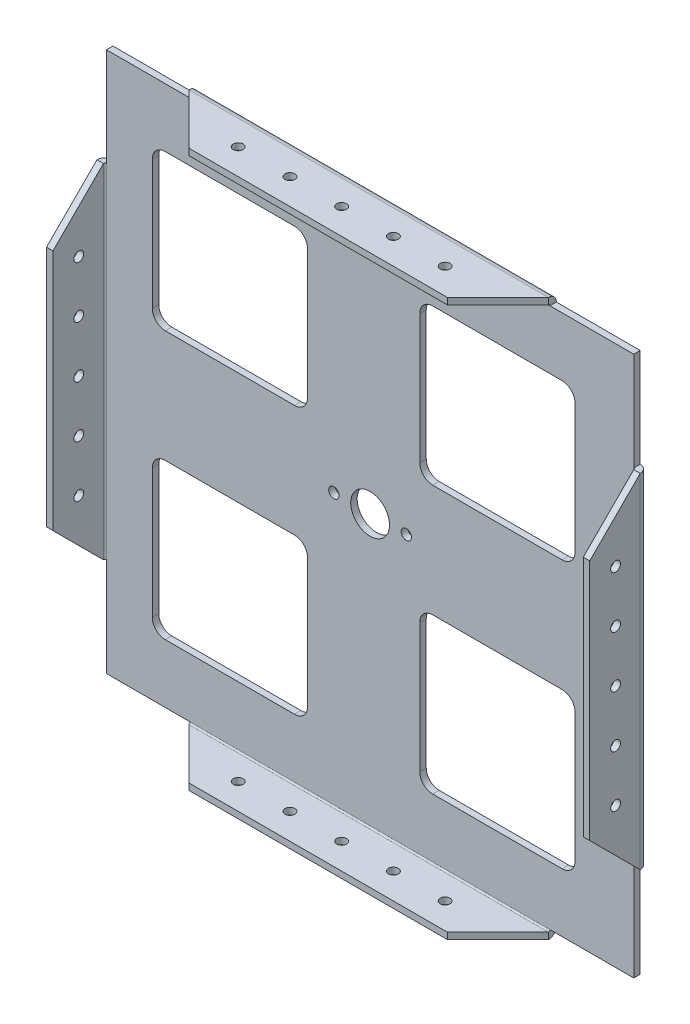
from build123d import *

# Parameters (mm, degrees)
SKETCH1_W                     = 266.7
SKETCH1_H                     = 273.05
SKETCH1_R                     = 9.525
SKETCH1_R_2                   = 2.54
BASE_FLANGE4_DEPTH            = 3.175
EDGE_FLANGE13_STRIP_W         = 14.1732
EDGE_FLANGE13_STRIP_H         = 3.175
EDGE_FLANGE13_STRIP_CUT_DEPTH = 266.7
EDGE_FLANGE13_DEPTH           = 266.7
EDGE_FLANGE14_STRIP_W         = 14.1732
EDGE_FLANGE14_STRIP_H         = 3.175
EDGE_FLANGE14_STRIP_CUT_DEPTH = 266.7
EDGE_FLANGE14_DEPTH           = 266.7
SKETCH97_W                    = 44.45
SKETCH97_H                    = 24.7904
CUT_EXTRUDE17_DEPTH           = 47.752
SKETCH98_W                    = 44.45
SKETCH98_H                    = 24.7904
CUT_EXTRUDE18_DEPTH           = 47.752
SKETCH99_W                    = 44.45
SKETCH99_H                    = 24.7904
CUT_EXTRUDE19_DEPTH           = 47.752
SKETCH100_W                   = 44.45
SKETCH100_H                   = 24.7904
CUT_EXTRUDE20_DEPTH           = 47.752
EDGE_FLANGE15_STRIP_W         = 14.1732
EDGE_FLANGE15_STRIP_H         = 3.175
EDGE_FLANGE15_STRIP_CUT_DEPTH = 265.2268
EDGE_FLANGE15_DEPTH           = 265.2268
EDGE_FLANGE16_STRIP_W         = 14.1732
EDGE_FLANGE16_STRIP_H         = 3.175
EDGE_FLANGE16_STRIP_CUT_DEPTH = 265.2268
EDGE_FLANGE16_DEPTH           = 265.2268
SKETCH107_W                   = 24.7904
SKETCH107_H                   = 47.752
CUT_EXTRUDE21_DEPTH           = 47.752
SKETCH108_W                   = 24.7904
SKETCH108_H                   = 47.752
CUT_EXTRUDE22_DEPTH           = 47.752
SKETCH109_W                   = 24.7904
SKETCH109_H                   = 47.752
CUT_EXTRUDE23_DEPTH           = 47.752
SKETCH110_W                   = 24.7904
SKETCH110_H                   = 47.752
CUT_EXTRUDE24_DEPTH           = 47.752
CHAMFER5_SIZE                 = 25.4
SKETCH113_R                   = 2.413
CUT_EXTRUDE25_DEPTH           = 306.44213946
SKETCH114_R                   = 2.413
CUT_EXTRUDE26_DEPTH           = 316.967399731
CUT_EXTRUDE28_START           = -45.0596
CUT_EXTRUDE28_DEPTH           = 45.0596
CUT_EXTRUDE29_DEPTH           = 45.0596
CUT_EXTRUDE30_START           = -48.3616
CUT_EXTRUDE30_DEPTH           = 48.3616
CUT_EXTRUDE31_DEPTH           = 45.0596
CUT_EXTRUDE32_START           = -45.0596
CUT_EXTRUDE32_DEPTH           = 45.0596
CUT_EXTRUDE33_DEPTH           = 48.3616
CUT_EXTRUDE34_DEPTH           = 48.3616
CUT_EXTRUDE35_START           = -48.3616
CUT_EXTRUDE35_DEPTH           = 48.3616


# Sheet-metal steps are written as plain solids
with BuildPart() as part:
    # Sketch1 → Base-Flange4 (new body)
    with BuildSketch(Plane.XY):
        with Locations((1.137807361, -30.97091029)):
            Rectangle(SKETCH1_W, SKETCH1_H)
        with Locations((1.137807361, -30.97091029)):
            Circle(SKETCH1_R, mode=Mode.SUBTRACT)
        with Locations((-16.642192639, -30.84391029)):
            Circle(SKETCH1_R_2, mode=Mode.SUBTRACT)
        with Locations((18.917353784, -30.84391029)):
            Circle(SKETCH1_R_2, mode=Mode.SUBTRACT)
        with BuildLine():
            Line((-99.446192639, 72.78808971), (-35.946192639, 72.78808971))
            ThreePointArc((-35.946192639, 72.78808971), (-31.456064579, 70.92821777), (-29.596192639, 66.43808971))
            Line((-29.596192639, 66.43808971), (-29.596192639, 2.93808971))
            ThreePointArc((-29.596192639, 2.93808971), (-31.456064579, -1.552038351), (-35.946192639, -3.41191029))
            Line((-35.946192639, -3.41191029), (-99.446192639, -3.41191029))
            ThreePointArc((-99.446192639, -3.41191029), (-103.9363207, -1.552038351), (-105.796192639, 2.93808971))
            Line((-105.796192639, 2.93808971), (-105.796192639, 66.43808971))
            ThreePointArc((-105.796192639, 66.43808971), (-103.9363207, 70.92821777), (-99.446192639, 72.78808971))
        make_face(mode=Mode.SUBTRACT)
        with BuildLine():
            Line((31.871807361, 72.78808971), (95.371807361, 72.78808971))
            ThreePointArc((95.371807361, 72.78808971), (99.861935421, 70.92821777), (101.721807361, 66.43808971))
            Line((101.721807361, 66.43808971), (101.721807361, 2.93808971))
            ThreePointArc((101.721807361, 2.93808971), (99.861935421, -1.552038351), (95.371807361, -3.41191029))
            Line((95.371807361, -3.41191029), (31.871807361, -3.41191029))
            ThreePointArc((31.871807361, -3.41191029), (27.3816793, -1.552038351), (25.521807361, 2.93808971))
            Line((25.521807361, 2.93808971), (25.521807361, 66.43808971))
            ThreePointArc((25.521807361, 66.43808971), (27.3816793, 70.92821777), (31.871807361, 72.78808971))
        make_face(mode=Mode.SUBTRACT)
        with BuildLine():
            Line((-99.446192639, -58.52991029), (-35.946192639, -58.52991029))
            ThreePointArc((-35.946192639, -58.52991029), (-31.456064579, -60.38978223), (-29.596192639, -64.87991029))
            Line((-29.596192639, -64.87991029), (-29.596192639, -128.37991029))
            ThreePointArc((-29.596192639, -128.37991029), (-31.456064579, -132.870038351), (-35.946192639, -134.72991029))
            Line((-35.946192639, -134.72991029), (-99.446192639, -134.72991029))
            ThreePointArc((-99.446192639, -134.72991029), (-103.9363207, -132.870038351), (-105.796192639, -128.37991029))
            Line((-105.796192639, -128.37991029), (-105.796192639, -64.87991029))
            ThreePointArc((-105.796192639, -64.87991029), (-103.9363207, -60.38978223), (-99.446192639, -58.52991029))
        make_face(mode=Mode.SUBTRACT)
        with BuildLine():
            Line((31.871807361, -58.52991029), (95.371807361, -58.52991029))
            ThreePointArc((95.371807361, -58.52991029), (99.861935421, -60.38978223), (101.721807361, -64.87991029))
            Line((101.721807361, -64.87991029), (101.721807361, -128.37991029))
            ThreePointArc((101.721807361, -128.37991029), (99.861935421, -132.870038351), (95.371807361, -134.72991029))
            Line((95.371807361, -134.72991029), (31.871807361, -134.72991029))
            ThreePointArc((31.871807361, -134.72991029), (27.3816793, -132.870038351), (25.521807361, -128.37991029))
            Line((25.521807361, -128.37991029), (25.521807361, -64.87991029))
            ThreePointArc((25.521807361, -64.87991029), (27.3816793, -60.38978223), (31.871807361, -58.52991029))
        make_face(mode=Mode.SUBTRACT)
    extrude(amount=-BASE_FLANGE4_DEPTH)

    # Edge-Flange13 strip (across the edge) → Edge-Flange13 strip cut (cut)
    with BuildSketch(Plane(origin=(-132.212192639, -167.49591029, 0), x_dir=(0, 1, 0), z_dir=(1, 0, 0))):
        with Locations((-3.175, -1.5875)):
            Rectangle(EDGE_FLANGE13_STRIP_W, EDGE_FLANGE13_STRIP_H)
    extrude(amount=EDGE_FLANGE13_STRIP_CUT_DEPTH, mode=Mode.SUBTRACT)

    # Edge-Flange13 section (across the edge) → Edge-Flange13 (add)
    with BuildSketch(Plane(origin=(-132.212192639, -167.49591029, 0), x_dir=(0, 1, 0), z_dir=(1, 0, 0))):
        with BuildLine():
            Line((0, 0.7366), (0, 25.527))
            Line((0, 25.527), (3.175, 25.527))
            Line((3.175, 25.527), (3.175, 0.7366))
            ThreePointArc((3.175, 0.7366), (3.390745145, 0.215745145), (3.9116, 0))
            Line((3.9116, 0), (3.9116, -3.175))
            ThreePointArc((3.9116, -3.175), (1.145681115, -2.029318885), (0, 0.7366))
        make_face()
    extrude(amount=EDGE_FLANGE13_DEPTH)

    # Edge-Flange14 strip (across the edge) → Edge-Flange14 strip cut (cut)
    with BuildSketch(Plane(origin=(134.487807361, 105.55408971, 0), x_dir=(0, -1, 0), z_dir=(-1, 0, 0))):
        with Locations((-3.175, -1.5875)):
            Rectangle(EDGE_FLANGE14_STRIP_W, EDGE_FLANGE14_STRIP_H)
    extrude(amount=EDGE_FLANGE14_STRIP_CUT_DEPTH, mode=Mode.SUBTRACT)

    # Edge-Flange14 section (across the edge) → Edge-Flange14 (add)
    with BuildSketch(Plane(origin=(134.487807361, 105.55408971, 0), x_dir=(0, -1, 0), z_dir=(-1, 0, 0))):
        with BuildLine():
            Line((0, 0.7366), (0, 25.527))
            Line((0, 25.527), (3.175, 25.527))
            Line((3.175, 25.527), (3.175, 0.7366))
            ThreePointArc((3.175, 0.7366), (3.390745145, 0.215745145), (3.9116, 0))
            Line((3.9116, 0), (3.9116, -3.175))
            ThreePointArc((3.9116, -3.175), (1.145681115, -2.029318885), (0, 0.7366))
        make_face()
    extrude(amount=EDGE_FLANGE14_DEPTH)

    # Sketch97 → Cut-Extrude17 (cut)
    with BuildSketch(Plane(origin=(0, -164.32091029, 0), x_dir=(1, 0, 0), z_dir=(0, 1, 0))):
        with Locations((112.262807361, -13.1318)):
            Rectangle(SKETCH97_W, SKETCH97_H)
    extrude(amount=-CUT_EXTRUDE17_DEPTH, mode=Mode.SUBTRACT)

    # Sketch98 → Cut-Extrude18 (cut)
    with BuildSketch(Plane(origin=(0, -164.32091029, 0), x_dir=(1, 0, 0), z_dir=(0, 1, 0))):
        with Locations((-109.987192639, -13.1318)):
            Rectangle(SKETCH98_W, SKETCH98_H)
    extrude(amount=-CUT_EXTRUDE18_DEPTH, mode=Mode.SUBTRACT)

    # Sketch99 → Cut-Extrude19 (cut)
    with BuildSketch(Plane(origin=(0, 105.55408971, 0), x_dir=(1, 0, 0), z_dir=(0, 1, 0))):
        with Locations((112.262807361, -13.1318)):
            Rectangle(SKETCH99_W, SKETCH99_H)
    extrude(amount=-CUT_EXTRUDE19_DEPTH, mode=Mode.SUBTRACT)

    # Sketch100 → Cut-Extrude20 (cut)
    with BuildSketch(Plane(origin=(0, 105.55408971, 0), x_dir=(1, 0, 0), z_dir=(0, 1, 0))):
        with Locations((-109.987192639, -13.1318)):
            Rectangle(SKETCH100_W, SKETCH100_H)
    extrude(amount=-CUT_EXTRUDE20_DEPTH, mode=Mode.SUBTRACT)

    # Edge-Flange15 strip (across the edge) → Edge-Flange15 strip cut (cut)
    with BuildSketch(Plane(origin=(134.487807361, -163.58431029, 0), x_dir=(-1, 0, 0), z_dir=(0, 1, 0))):
        with Locations((-3.175, -1.5875)):
            Rectangle(EDGE_FLANGE15_STRIP_W, EDGE_FLANGE15_STRIP_H)
    extrude(amount=EDGE_FLANGE15_STRIP_CUT_DEPTH, mode=Mode.SUBTRACT)

    # Edge-Flange15 section (across the edge) → Edge-Flange15 (add)
    with BuildSketch(Plane(origin=(134.487807361, -163.58431029, 0), x_dir=(-1, 0, 0), z_dir=(0, 1, 0))):
        with BuildLine():
            Line((0, 0.7366), (0, 25.527))
            Line((0, 25.527), (3.175, 25.527))
            Line((3.175, 25.527), (3.175, 0.7366))
            ThreePointArc((3.175, 0.7366), (3.390745145, 0.215745145), (3.9116, 0))
            Line((3.9116, 0), (3.9116, -3.175))
            ThreePointArc((3.9116, -3.175), (1.145681115, -2.029318885), (0, 0.7366))
        make_face()
    extrude(amount=EDGE_FLANGE15_DEPTH)

    # Edge-Flange16 strip (across the edge) → Edge-Flange16 strip cut (cut)
    with BuildSketch(Plane(origin=(-132.212192639, 101.64248971, 0), x_dir=(1, 0, 0), z_dir=(0, -1, 0))):
        with Locations((-3.175, -1.5875)):
            Rectangle(EDGE_FLANGE16_STRIP_W, EDGE_FLANGE16_STRIP_H)
    extrude(amount=EDGE_FLANGE16_STRIP_CUT_DEPTH, mode=Mode.SUBTRACT)

    # Edge-Flange16 section (across the edge) → Edge-Flange16 (add)
    with BuildSketch(Plane(origin=(-132.212192639, 101.64248971, 0), x_dir=(1, 0, 0), z_dir=(0, -1, 0))):
        with BuildLine():
            Line((0, 0.7366), (0, 25.527))
            Line((0, 25.527), (3.175, 25.527))
            Line((3.175, 25.527), (3.175, 0.7366))
            ThreePointArc((3.175, 0.7366), (3.390745145, 0.215745145), (3.9116, 0))
            Line((3.9116, 0), (3.9116, -3.175))
            ThreePointArc((3.9116, -3.175), (1.145681115, -2.029318885), (0, 0.7366))
        make_face()
    extrude(amount=EDGE_FLANGE16_DEPTH)

    # Sketch107 → Cut-Extrude21 (cut)
    with BuildSketch(Plane.ZY.offset(132.212192639)):
        with Locations((13.1318, 77.76648971)):
            Rectangle(SKETCH107_W, SKETCH107_H)
    extrude(amount=-CUT_EXTRUDE21_DEPTH, mode=Mode.SUBTRACT)

    # Sketch108 → Cut-Extrude22 (cut)
    with BuildSketch(Plane.ZY.offset(132.212192639)):
        with Locations((13.1318, -139.70831029)):
            Rectangle(SKETCH108_W, SKETCH108_H)
    extrude(amount=-CUT_EXTRUDE22_DEPTH, mode=Mode.SUBTRACT)

    # Sketch109 → Cut-Extrude23 (cut)
    with BuildSketch(Plane(origin=(134.487807361, 0, 0), x_dir=(0, 0, -1), z_dir=(1, 0, 0))):
        with Locations((-13.1318, -139.70831029)):
            Rectangle(SKETCH109_W, SKETCH109_H)
    extrude(amount=-CUT_EXTRUDE23_DEPTH, mode=Mode.SUBTRACT)

    # Sketch110 → Cut-Extrude24 (cut)
    with BuildSketch(Plane(origin=(134.487807361, 0, 0), x_dir=(0, 0, -1), z_dir=(1, 0, 0))):
        with Locations((-13.1318, 77.76648971)):
            Rectangle(SKETCH110_W, SKETCH110_H)
    extrude(amount=-CUT_EXTRUDE24_DEPTH, mode=Mode.SUBTRACT)

    # Chamfer5
    # the kernel refuses this chamfer: 25.4 mm, written as the material it takes off along each edge
    with BuildSketch(Plane(origin=(90.037807361, -99.000162396, 25.527), x_dir=(-0.9996219169112966, 0, 0.027495876610586324), z_dir=(0, -1, 0))) as chamfer5_piece_1_section:
        Polygon((CHAMFER5_SIZE * 0.999621916911, CHAMFER5_SIZE * 0.0274958766106), (-CHAMFER5_SIZE * 0.0274958766106, CHAMFER5_SIZE * 0.999621916911), (0, 0), align=None)
    chamfer5_piece_1 = extrude(amount=133.816495789, mode=Mode.PRIVATE)
    chamfer5_piece_1 = split(chamfer5_piece_1, bisect_by=Plane(origin=(81.623550107, -165.90841029, 0.7366), z_dir=(0, 0, 1)), keep=Keep.TOP, mode=Mode.PRIVATE)
    add(chamfer5_piece_1, mode=Mode.SUBTRACT)
    with BuildSketch(Plane(origin=(199.808555255, -115.83231029, 25.527), x_dir=(-3.257797378778914e-15, -0.0274958766105862, -0.9996219169112966), z_dir=(-1, 0, 0))) as chamfer5_piece_2_section:
        Polygon((CHAMFER5_SIZE * 0.999621916911, -CHAMFER5_SIZE * 0.0274958766106), (-CHAMFER5_SIZE * 0.0274958766106, -CHAMFER5_SIZE * 0.999621916911), (0, 0), align=None)
    chamfer5_piece_2 = extrude(amount=133.816495789, mode=Mode.PRIVATE)
    chamfer5_piece_2 = split(chamfer5_piece_2, bisect_by=Plane(origin=(132.900307361, -107.418053037, 0.7366), z_dir=(0, 0, 1)), keep=Keep.TOP, mode=Mode.PRIVATE)
    add(chamfer5_piece_2, mode=Mode.SUBTRACT)
    with BuildSketch(Plane(origin=(-87.762192639, -99.000162396, 25.527), x_dir=(-0.0274958766105862, 3.2606747798650146e-15, -0.9996219169112966), z_dir=(0, -1, 0))) as chamfer5_piece_3_section:
        Polygon((CHAMFER5_SIZE * 0.999621916911, CHAMFER5_SIZE * 0.0274958766106), (-CHAMFER5_SIZE * 0.0274958766106, CHAMFER5_SIZE * 0.999621916911), (0, 0), align=None)
    chamfer5_piece_3 = extrude(amount=133.816495789, mode=Mode.PRIVATE)
    chamfer5_piece_3 = split(chamfer5_piece_3, bisect_by=Plane(origin=(-79.347935385, -165.90841029, 0.7366), z_dir=(0, 0, 1)), keep=Keep.TOP, mode=Mode.PRIVATE)
    add(chamfer5_piece_3, mode=Mode.SUBTRACT)
    with BuildSketch(Plane(origin=(-197.532940533, -115.83231029, 25.527), x_dir=(0, 0.9996219169112968, 0.027495876610586365), z_dir=(1, 0, 0))) as chamfer5_piece_4_section:
        Polygon((CHAMFER5_SIZE * 0.999621916911, -CHAMFER5_SIZE * 0.0274958766106), (-CHAMFER5_SIZE * 0.0274958766106, -CHAMFER5_SIZE * 0.999621916911), (0, 0), align=None)
    chamfer5_piece_4 = extrude(amount=133.816495789, mode=Mode.PRIVATE)
    chamfer5_piece_4 = split(chamfer5_piece_4, bisect_by=Plane(origin=(-130.624692639, -107.418053037, 0.7366), z_dir=(0, 0, 1)), keep=Keep.TOP, mode=Mode.PRIVATE)
    add(chamfer5_piece_4, mode=Mode.SUBTRACT)
    with BuildSketch(Plane(origin=(-197.532940533, 53.89048971, 25.527), x_dir=(4.344688972067252e-15, 0.027495876610586743, -0.9996219169112966), z_dir=(1, 0, 0))) as chamfer5_piece_5_section:
        Polygon((CHAMFER5_SIZE * 0.999621916911, -CHAMFER5_SIZE * 0.0274958766106), (-CHAMFER5_SIZE * 0.0274958766106, -CHAMFER5_SIZE * 0.999621916911), (0, 0), align=None)
    chamfer5_piece_5 = extrude(amount=133.816495789, mode=Mode.PRIVATE)
    chamfer5_piece_5 = split(chamfer5_piece_5, bisect_by=Plane(origin=(-130.624692639, 45.476232456, 0.7366), z_dir=(0, 0, 1)), keep=Keep.TOP, mode=Mode.PRIVATE)
    add(chamfer5_piece_5, mode=Mode.SUBTRACT)
    with BuildSketch(Plane(origin=(-87.762192639, 170.874837604, 25.527), x_dir=(0.9996219169112966, 0, 0.027495876610586324), z_dir=(0, -1, 0))) as chamfer5_piece_6_section:
        Polygon((CHAMFER5_SIZE * 0.999621916911, -CHAMFER5_SIZE * 0.0274958766106), (-CHAMFER5_SIZE * 0.0274958766106, -CHAMFER5_SIZE * 0.999621916911), (0, 0), align=None)
    chamfer5_piece_6 = extrude(amount=133.816495789, mode=Mode.PRIVATE)
    chamfer5_piece_6 = split(chamfer5_piece_6, bisect_by=Plane(origin=(-79.347935385, 103.96658971, 0.7366), z_dir=(0, 0, 1)), keep=Keep.TOP, mode=Mode.PRIVATE)
    add(chamfer5_piece_6, mode=Mode.SUBTRACT)
    with BuildSketch(Plane(origin=(199.808555255, 53.89048971, 25.527), x_dir=(0, -0.9996219169112968, 0.02749587661058633), z_dir=(-1, 0, 0))) as chamfer5_piece_7_section:
        Polygon((CHAMFER5_SIZE * 0.999621916911, -CHAMFER5_SIZE * 0.0274958766106), (-CHAMFER5_SIZE * 0.0274958766106, -CHAMFER5_SIZE * 0.999621916911), (0, 0), align=None)
    chamfer5_piece_7 = extrude(amount=133.816495789, mode=Mode.PRIVATE)
    chamfer5_piece_7 = split(chamfer5_piece_7, bisect_by=Plane(origin=(132.900307361, 45.476232456, 0.7366), z_dir=(0, 0, 1)), keep=Keep.TOP, mode=Mode.PRIVATE)
    add(chamfer5_piece_7, mode=Mode.SUBTRACT)
    with BuildSketch(Plane(origin=(90.037807361, 170.874837604, 25.527), x_dir=(0.0274958766105862, -3.2606747798650146e-15, -0.9996219169112966), z_dir=(0, -1, 0))) as chamfer5_piece_8_section:
        Polygon((CHAMFER5_SIZE * 0.999621916911, -CHAMFER5_SIZE * 0.0274958766106), (-CHAMFER5_SIZE * 0.0274958766106, -CHAMFER5_SIZE * 0.999621916911), (0, 0), align=None)
    chamfer5_piece_8 = extrude(amount=133.816495789, mode=Mode.PRIVATE)
    chamfer5_piece_8 = split(chamfer5_piece_8, bisect_by=Plane(origin=(81.623550107, 103.96658971, 0.7366), z_dir=(0, 0, 1)), keep=Keep.TOP, mode=Mode.PRIVATE)
    add(chamfer5_piece_8, mode=Mode.SUBTRACT)

    # Sketch113 → Cut-Extrude25 (cut, through all)
    with BuildSketch(Plane(origin=(0, 105.55408971, 0), x_dir=(1, 0, 0), z_dir=(0, 1, 0))):
        with Locations(Location((50.8, -12.827, 0), (0, 0, 270))):
            Circle(SKETCH113_R)
        with Locations(Location((25.4, -12.827, 0), (0, 0, 270))):
            Circle(SKETCH113_R)
        with Locations(Location((0, -12.827, 0), (0, 0, 270))):
            Circle(SKETCH113_R)
        with Locations(Location((-25.4, -12.827, 0), (0, 0, 270))):
            Circle(SKETCH113_R)
        with Locations(Location((-50.8, -12.827, 0), (0, 0, 270))):
            Circle(SKETCH113_R)
    extrude(amount=-CUT_EXTRUDE25_DEPTH, mode=Mode.SUBTRACT)

    # Sketch114 → Cut-Extrude26 (cut, through all)
    with BuildSketch(Plane(origin=(134.487807361, 0, 0), x_dir=(0, 0, -1), z_dir=(1, 0, 0))):
        with Locations((-12.827, -81.84711029)):
            Circle(SKETCH114_R)
        with Locations((-12.827, -56.44711029)):
            Circle(SKETCH114_R)
        with Locations((-12.827, -31.04711029)):
            Circle(SKETCH114_R)
        with Locations((-12.827, -5.64711029)):
            Circle(SKETCH114_R)
        with Locations((-12.827, 19.75288971)):
            Circle(SKETCH114_R)
    extrude(amount=-CUT_EXTRUDE26_DEPTH, mode=Mode.SUBTRACT)

    # Sketch115 → Cut-Extrude28 (cut)
    with BuildSketch(Plane(origin=(134.487807361, 0, 0), x_dir=(0, 0, -1), z_dir=(1, 0, 0)).offset(CUT_EXTRUDE28_START)):
        with BuildLine():
            Line((-0.7366, -167.49591029), (-0.7366, -164.32091029))
            ThreePointArc((-0.7366, -164.32091029), (-0.215745145, -164.105165145), (0, -163.58431029))
            Line((0, -163.58431029), (3.175, -163.58431029))
            ThreePointArc((3.175, -163.58431029), (2.029318885, -166.350229176), (-0.7366, -167.49591029))
        make_face()
    extrude(amount=CUT_EXTRUDE28_DEPTH, mode=Mode.SUBTRACT)

    # Sketch116 → Cut-Extrude29 (cut)
    with BuildSketch(Plane.ZY.offset(132.212192639)):
        with BuildLine():
            Line((0, -163.58431029), (-3.175, -163.58431029))
            ThreePointArc((-3.175, -163.58431029), (-2.029318885, -166.350229176), (0.7366, -167.49591029))
            Line((0.7366, -167.49591029), (0.7366, -164.32091029))
            ThreePointArc((0.7366, -164.32091029), (0.215745145, -164.105165145), (0, -163.58431029))
        make_face()
    extrude(amount=-CUT_EXTRUDE29_DEPTH, mode=Mode.SUBTRACT)

    # Sketch117 → Cut-Extrude30 (cut)
    with BuildSketch(Plane.XZ.offset(163.58431029).offset(CUT_EXTRUDE30_START)):
        with BuildLine():
            Line((-129.037192639, 0.7366), (-132.212192639, 0.7366))
            ThreePointArc((-132.212192639, 0.7366), (-131.066511524, -2.029318885), (-128.300592639, -3.175))
            Line((-128.300592639, -3.175), (-128.300592639, 0))
            ThreePointArc((-128.300592639, 0), (-128.821447494, 0.215745145), (-129.037192639, 0.7366))
        make_face()
    extrude(amount=CUT_EXTRUDE30_DEPTH, mode=Mode.SUBTRACT)

    # Sketch118 → Cut-Extrude31 (cut)
    with BuildSketch(Plane(origin=(134.487807361, 0, 0), x_dir=(0, 0, -1), z_dir=(1, 0, 0))):
        with BuildLine():
            Line((-0.7366, 102.37908971), (-0.7366, 105.55408971))
            ThreePointArc((-0.7366, 105.55408971), (2.029318885, 104.408408595), (3.175, 101.64248971))
            Line((3.175, 101.64248971), (0, 101.64248971))
            ThreePointArc((0, 101.64248971), (-0.215745145, 102.163344565), (-0.7366, 102.37908971))
        make_face()
    extrude(amount=-CUT_EXTRUDE31_DEPTH, mode=Mode.SUBTRACT)

    # Sketch119 → Cut-Extrude32 (cut)
    with BuildSketch(Plane.ZY.offset(132.212192639).offset(CUT_EXTRUDE32_START)):
        with BuildLine():
            Line((0.7366, 102.37908971), (0.7366, 105.55408971))
            ThreePointArc((0.7366, 105.55408971), (-2.029318885, 104.408408595), (-3.175, 101.64248971))
            Line((-3.175, 101.64248971), (0, 101.64248971))
            ThreePointArc((0, 101.64248971), (0.215745145, 102.163344565), (0.7366, 102.37908971))
        make_face()
    extrude(amount=CUT_EXTRUDE32_DEPTH, mode=Mode.SUBTRACT)

    # Sketch120 → Cut-Extrude33 (cut)
    with BuildSketch(Plane(origin=(0, 101.64248971, 0), x_dir=(1, 0, 0), z_dir=(0, 1, 0))):
        with BuildLine():
            Line((-129.037192639, -0.7366), (-132.212192639, -0.7366))
            ThreePointArc((-132.212192639, -0.7366), (-131.066511524, 2.029318885), (-128.300592639, 3.175))
            Line((-128.300592639, 3.175), (-128.300592639, 0))
            ThreePointArc((-128.300592639, 0), (-128.821447494, -0.215745145), (-129.037192639, -0.7366))
        make_face()
    extrude(amount=-CUT_EXTRUDE33_DEPTH, mode=Mode.SUBTRACT)

    # Sketch121 → Cut-Extrude34 (cut)
    with BuildSketch(Plane.XZ.offset(163.58431029)):
        with BuildLine():
            Line((131.312807361, 0.7366), (134.487807361, 0.7366))
            ThreePointArc((134.487807361, 0.7366), (133.342126246, -2.029318885), (130.576207361, -3.175))
            Line((130.576207361, -3.175), (130.576207361, 0))
            ThreePointArc((130.576207361, 0), (131.097062216, 0.215745145), (131.312807361, 0.7366))
        make_face()
    extrude(amount=-CUT_EXTRUDE34_DEPTH, mode=Mode.SUBTRACT)

    # Sketch122 → Cut-Extrude35 (cut)
    with BuildSketch(Plane(origin=(0, 101.64248971, 0), x_dir=(1, 0, 0), z_dir=(0, 1, 0)).offset(CUT_EXTRUDE35_START)):
        with BuildLine():
            Line((134.487807361, -0.7366), (131.312807361, -0.7366))
            ThreePointArc((131.312807361, -0.7366), (131.097062216, -0.215745145), (130.576207361, 0))
            Line((130.576207361, 0), (130.576207361, 3.175))
            ThreePointArc((130.576207361, 3.175), (133.342126246, 2.029318885), (134.487807361, -0.7366))
        make_face()
    extrude(amount=CUT_EXTRUDE35_DEPTH, mode=Mode.SUBTRACT)


solid = part.part
